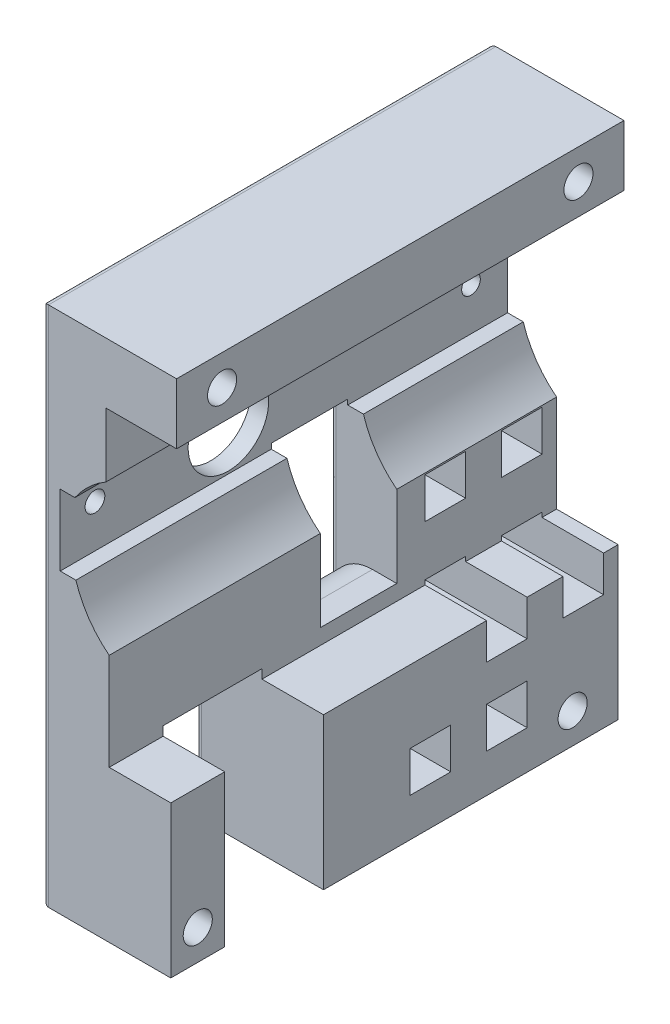
from build123d import *

# Parameters (mm, degrees)
PROFILEEXTRUDE_DEPTH    = 73.76
HOSEWINDOW_W            = 16.29
HOSEWINDOW_H            = 26.5
HOSEWINDOWCUT_DEPTH     = 95.161864378
CAGESCREWS_R            = 2.4
CAGESCREWSCUT_DEPTH     = 95.161864378
AXLEHOLECUT_DEPTH       = 95.161864378
SETSCREWHOLES_R         = 1.539432213
SETSCREWHOLES_R_2       = 1.628953018
SETSCREWHOLESCUT_DEPTH  = 95.161864456
VELOCITYWINDOW_W        = 12.61
VELOCITYWINDOW_H        = 22.29
VELOCITYWINDOWCUT_DEPTH = 95.161864456
FILLET3_R               = 7
TRIGGERRACKSLOTCUT_W    = 6.7
TRIGGERRACKSLOTCUT_H    = 6.7
RACKSLOTCUT_DEPTH       = 95.161864456
FILLET4_R               = 1


with BuildPart() as part:
    # Profile → ProfileExtrude (new body)
    with BuildSketch(Plane.XY):
        with BuildLine():
            Line((9.301269376, -54.194713793), (9.301269376, -29.194713793))
            Line((9.301269376, -29.194713793), (-0.848730624, -29.194713793))
            Line((-0.848730624, -29.194713793), (-0.848730624, -13.194713793))
            ThreePointArc((-0.848730624, -13.194713793), (-4.204080189, -9.618555822), (-6.340730624, -5.204713793))
            Line((-6.340730624, -5.204713793), (-8.928730624, -5.204713793))
            Line((-8.928730624, -5.204713793), (-8.928730624, 6.495286207))
            Line((-8.928730624, 6.495286207), (-6.509650624, 6.495286207))
            ThreePointArc((-6.509650624, 6.495286207), (-4.210311879, 9.168674207), (-1.388730624, 11.283536207))
            Line((-1.388730624, 11.283536207), (-1.388730624, 21.845286207))
            Line((-1.388730624, 21.845286207), (10.261269376, 21.845286207))
            Line((10.261269376, 21.845286207), (10.261269376, 31.845286207))
            Line((10.261269376, 31.845286207), (-11.848730624, 31.845286207))
            Line((-11.848730624, 31.845286207), (-11.848730624, -54.194713793))
            Line((-11.848730624, -54.194713793), (9.301269376, -54.194713793))
        make_face()
    extrude(amount=PROFILEEXTRUDE_DEPTH)

    # HoseWindow → HoseWindowCut (cut, through all)
    with BuildSketch(Plane.ZY.offset(11.848730624)):
        with Locations((56.725, -40.944713793)):
            Rectangle(HOSEWINDOW_W, HOSEWINDOW_H)
    extrude(amount=-HOSEWINDOWCUT_DEPTH, mode=Mode.SUBTRACT)

    # CageScrews → CageScrewsCut (cut, through all)
    with BuildSketch(Plane.ZY.offset(11.848730624)):
        with Locations((7.5, 26.845286207)):
            Circle(CAGESCREWS_R)
        with Locations((66.26, 26.845286207)):
            Circle(CAGESCREWS_R)
        with Locations((7.5, -49.194713793)):
            Circle(CAGESCREWS_R)
        with Locations((69.31, -49.194713793)):
            Circle(CAGESCREWS_R)
    extrude(amount=-CAGESCREWSCUT_DEPTH, mode=Mode.SUBTRACT)

    # AxleHole → AxleHoleCut (cut, through all)
    with BuildSketch(Plane.ZY.offset(11.848730624)):
        with BuildLine():
            Line((47.361, 8.359497151), (47.361, 6.740497151))
            Line((47.361, 6.740497151), (44.699, 6.740497151))
            Line((44.699, 6.740497151), (44.699, 8.359497151))
            ThreePointArc((44.699, 8.359497151), (46.03, -4.783713793), (47.361, 8.359497151))
        make_face()
    extrude(amount=-AXLEHOLECUT_DEPTH, mode=Mode.SUBTRACT)

    # SetScrewHoles → SetScrewHolesCut (cut, through all)
    with BuildSketch(Plane.ZY.offset(11.848730624)):
        with Locations((6.03, 1.855286207)):
            Circle(SETSCREWHOLES_R)
        with Locations((68.03, 1.855286207)):
            Circle(SETSCREWHOLES_R_2)
    extrude(amount=-SETSCREWHOLESCUT_DEPTH, mode=Mode.SUBTRACT)

    # VelocityWindow → VelocityWindowCut (cut, through all)
    with BuildSketch(Plane.ZY.offset(11.848730624)):
        with Locations((32.655, -15.499713793)):
            Rectangle(VELOCITYWINDOW_W, VELOCITYWINDOW_H)
    extrude(amount=-VELOCITYWINDOWCUT_DEPTH, mode=Mode.SUBTRACT)

    # Fillet3
    fillet3_edges = [part.edges().sort_by_distance(p)[0] for p in [
        (-11.848730624, -26.644713793, 32.655),
    ]]
    fillet(fillet3_edges, radius=FILLET3_R)

    # TriggerRackSlotCut → RackSlotCut (cut, through all)
    with BuildSketch(Plane.ZY.offset(11.848730624)):
        with Locations((18.35, -44.494713793)):
            Rectangle(TRIGGERRACKSLOTCUT_W, TRIGGERRACKSLOTCUT_H)
        with Locations((30.95, -44.494713793)):
            Rectangle(TRIGGERRACKSLOTCUT_W, TRIGGERRACKSLOTCUT_H)
        with Locations((5.75, -31.794713793)):
            Rectangle(TRIGGERRACKSLOTCUT_W, TRIGGERRACKSLOTCUT_H)
        with Locations((18.35, -31.794713793)):
            Rectangle(TRIGGERRACKSLOTCUT_W, TRIGGERRACKSLOTCUT_H)
        with Locations((5.75, -16.794713793)):
            Rectangle(TRIGGERRACKSLOTCUT_W, TRIGGERRACKSLOTCUT_H)
        with Locations((18.35, -16.794713793)):
            Rectangle(TRIGGERRACKSLOTCUT_W, TRIGGERRACKSLOTCUT_H)
    extrude(amount=-RACKSLOTCUT_DEPTH, mode=Mode.SUBTRACT)

    # Fillet4
    fillet4_edges = [part.edges().sort_by_distance(p)[0] for p in [
        (-11.848730624, -31.794713793, 21.7),
        (-11.848730624, -28.444713793, 18.35),
        (-11.848730624, -31.794713793, 15),
        (-11.848730624, -35.144713793, 18.35),
        (-11.848730624, -47.844713793, 18.35),
        (-11.848730624, -44.494713793, 15),
        (-11.848730624, -41.144713793, 18.35),
        (-11.848730624, -44.494713793, 21.7),
        (-11.848730624, -47.844713793, 30.95),
        (-11.848730624, -44.494713793, 34.3),
        (-11.848730624, -18.999713793, 38.96),
        (-11.848730624, -4.354713793, 32.655),
        (-11.848730624, -18.999713793, 26.35),
        (-11.848730624, -11.174713793, 0),
        (-11.848730624, -54.194713793, 24.29),
        (-11.848730624, -40.944713793, 48.58),
        (-11.848730624, -27.694713793, 56.725),
        (-11.848730624, -40.944713793, 64.87),
        (-11.848730624, -54.194713793, 69.315),
        (-11.848730624, -11.174713793, 73.76),
        (-11.848730624, 31.845286207, 36.88),
        (-11.848730624, -44.494713793, 27.6),
        (-11.848730624, -41.144713793, 30.95),
        (-11.848730624, -35.144713793, 5.75),
        (-11.848730624, -31.794713793, 2.4),
        (-11.848730624, -31.794713793, 9.1),
        (-11.848730624, -28.444713793, 5.75),
        (-11.848730624, -13.444713793, 18.35),
        (-11.848730624, -16.794713793, 21.7),
        (-11.848730624, -20.144713793, 18.35),
        (-11.848730624, -16.794713793, 15),
        (-11.848730624, -16.794713793, 2.4),
        (-11.848730624, -20.144713793, 5.75),
        (-11.848730624, -16.794713793, 9.1),
        (-11.848730624, -13.444713793, 5.75),
    ]]
    fillet(fillet4_edges, radius=FILLET4_R)


solid = part.part
